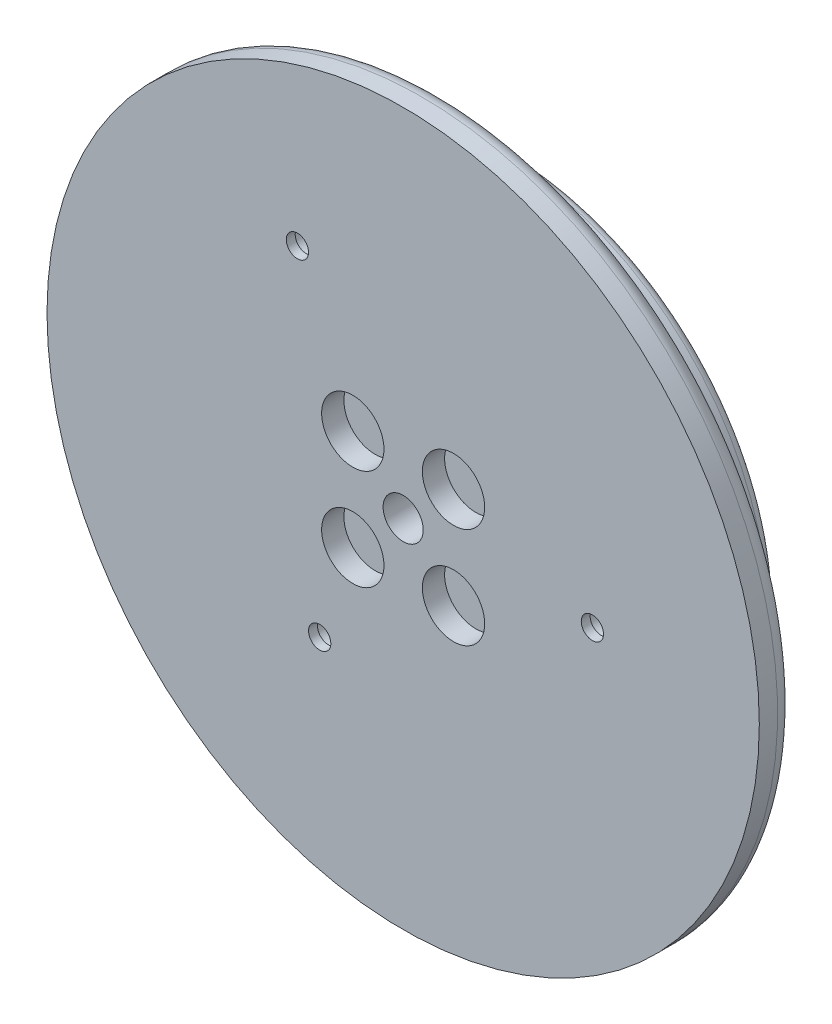
from build123d import *
from build123d.topology import SkipClean

# Parameters (mm, degrees)
SKETCH1_R             = 30
SKETCH1_R_2           = 12.5
BOSS_EXTRUDE1_DEPTH   = 6
SKETCH2_R             = 40
SKETCH2_R_2           = 2.25
SKETCH2_R_3           = 1.5
BOSS_EXTRUDE2_DEPTH   = 4
SKETCH3_R             = 3.5
CUT_EXTRUDE1_DEPTH    = 2.5
SKETCH4_R             = 5.15
CUT_EXTRUDE2_DEPTH    = 3
SKETCH5_R             = 3.5
BOSS_EXTRUDE3_DEPTH   = 0.2
SKETCH6_R             = 1.25
CUT_EXTRUDE3_DEPTH    = 10
SKETCH7_R             = 3.125
CUT_EXTRUDE4_DEPTH    = 9
SKETCH8_R             = 2
CUT_EXTRUDE5_DEPTH    = 8
SKETCH11_R            = 3
SKETCH11_R_2          = 1.5
BOSS_EXTRUDE6_DEPTH   = 3
BOSS_EXTRUDE6_2_DEPTH = 3
BOSS_EXTRUDE6_3_DEPTH = 3
SKETCH10_R            = 30
SKETCH10_R_2          = 5.15
SKETCH10_R_3          = 2
SKETCH10_R_4          = 12.5
BOSS_EXTRUDE7_DEPTH   = 1.2
FILLET1_R             = 10
FILLET2_R             = 2
BOSS_EXTRUDE8_START   = 2
SKETCH12_R            = 12.5
SKETCH12_R_2          = 2.25
SKETCH12_R_3          = 1.5
BOSS_EXTRUDE8_DEPTH   = 2
BOSS_EXTRUDE10_START  = 0.75
SKETCH15_R            = 30
SKETCH15_R_2          = 28
BOSS_EXTRUDE10_DEPTH  = 0.75
FILLET5_R             = 1
FILLET6_R             = 0.25


with BuildPart() as part:
    # Sketch1 → Boss-Extrude1 (new body)
    with BuildSketch(Plane.XY):
        Circle(SKETCH1_R)
        Circle(SKETCH1_R_2, mode=Mode.SUBTRACT)
    extrude(amount=BOSS_EXTRUDE1_DEPTH)

    # Sketch2 → Boss-Extrude2 (add)
    with BuildSketch(Plane.XY.offset(6)):
        Circle(SKETCH2_R)
        Circle(SKETCH2_R_2, mode=Mode.SUBTRACT)
        with Locations((-5.655999742, 5.657708628)):
            Circle(SKETCH2_R_3, mode=Mode.SUBTRACT)
        with Locations((-5.655999742, -5.657708628)):
            Circle(SKETCH2_R_3, mode=Mode.SUBTRACT)
        with Locations((5.655999742, -5.657708628)):
            Circle(SKETCH2_R_3, mode=Mode.SUBTRACT)
        with Locations((5.655999742, 5.657708628)):
            Circle(SKETCH2_R_3, mode=Mode.SUBTRACT)
    extrude(amount=BOSS_EXTRUDE2_DEPTH)

    # Sketch3 → Cut-Extrude1 (cut)
    with BuildSketch(Plane.XY.offset(10)):
        with Locations((-5.655999742, 5.657708628)):
            Circle(SKETCH3_R)
        with Locations((5.655999742, 5.657708628)):
            Circle(SKETCH3_R)
        with Locations((5.655999742, -5.657708628)):
            Circle(SKETCH3_R)
        with Locations((-5.655999742, -5.657708628)):
            Circle(SKETCH3_R)
    extrude(amount=-CUT_EXTRUDE1_DEPTH, mode=Mode.SUBTRACT)

    # Sketch4 → Cut-Extrude2 (cut)
    with BuildSketch(Plane(origin=(0, 0, 0), x_dir=(-1, 0, 0), z_dir=(0, 0, -1))):
        with Locations((20, 0)):
            Circle(SKETCH4_R)
    extrude(amount=-CUT_EXTRUDE2_DEPTH, mode=Mode.SUBTRACT)

    # Sketch5 → Boss-Extrude3 (add)
    with BuildSketch(Plane.XY.offset(7.5)):
        with Locations((-5.655999742, 5.657708628)):
            Circle(SKETCH5_R)
        with Locations((5.655999742, 5.657708628)):
            Circle(SKETCH5_R)
        with Locations((-5.655999742, -5.657708628)):
            Circle(SKETCH5_R)
        with Locations((5.655999742, -5.657708628)):
            Circle(SKETCH5_R)
    extrude(amount=-BOSS_EXTRUDE3_DEPTH)

    # Sketch6 → Cut-Extrude3 (cut)
    with BuildSketch(Plane(origin=(0, 0, 0), x_dir=(-1, 0, 0), z_dir=(0, 0, -1))):
        with Locations((-21.25, 0)):
            Circle(SKETCH6_R)
        with Locations((11.875, 20.56810334)):
            Circle(SKETCH6_R)
        with Locations((9.375, -16.237976321)):
            Circle(SKETCH6_R)
    extrude(amount=-CUT_EXTRUDE3_DEPTH, mode=Mode.SUBTRACT)

    # Sketch7 → Cut-Extrude4 (cut)
    with BuildSketch(Plane(origin=(0, 0, 0), x_dir=(-1, 0, 0), z_dir=(0, 0, -1))):
        with Locations((-21.25, 0)):
            Circle(SKETCH7_R)
        with Locations((11.875, 20.56810334)):
            Circle(SKETCH7_R)
        with Locations((9.375, -16.237976321)):
            Circle(SKETCH7_R)
    extrude(amount=-CUT_EXTRUDE4_DEPTH, mode=Mode.SUBTRACT)

    # Sketch8 → Cut-Extrude5 (cut)
    with BuildSketch(Plane(origin=(0, 0, 0), x_dir=(-1, 0, 0), z_dir=(0, 0, -1))):
        with Locations((-10, -17.320508076)):
            Circle(SKETCH8_R)
        with Locations((-10, 17.320508076)):
            Circle(SKETCH8_R)
        with Locations((17.320508076, -10)):
            Circle(SKETCH8_R)
        with Locations((0, -20)):
            Circle(SKETCH8_R)
        with Locations((-17.320508076, -10)):
            Circle(SKETCH8_R)
        with Locations((-17.320508076, 10)):
            Circle(SKETCH8_R)
        with Locations((0, 20)):
            Circle(SKETCH8_R)
        with Locations((17.320508076, 10)):
            Circle(SKETCH8_R)
    extrude(amount=-CUT_EXTRUDE5_DEPTH, mode=Mode.SUBTRACT)

    # Fillet1
    # the kernel refuses this fillet: 10 mm, written as the material it adds along each edge
    with BuildSketch(Plane(origin=(0, 0, 6), x_dir=(1, 0, 0), z_dir=(0, -1, 0))) as fillet1_piece_1:
        with BuildLine():
            CenterArc((39.16515139, -10), FILLET1_R, 90, 66.421821522)
            Line((30, -6), (29.816696972, -5.92))
            ThreePointArc((29.816696972, -5.92), (29.8, -3), (29.8, 0))
            Line((29.8, 0), (30, 0.2))
            Line((30, 0.2), (39.16515139, 0.2))
            Line((39.16515139, 0.2), (39.16515139, 0))
        make_face()
    revolve(axis=Axis((0, 0, 6), (0, 0, 1)))

    # Fillet2
    fillet2_edges = [part.edges().sort_by_distance(p)[0] for p in [
        (-40, 0, 6),
    ]]
    fillet(fillet2_edges, radius=FILLET2_R)

    # Sketch12 → Boss-Extrude8 (add)
    with BuildSketch(Plane(origin=(0, 0, 6), x_dir=(-1, 0, 0), z_dir=(0, 0, -1)).offset(BOSS_EXTRUDE8_START)):
        Circle(SKETCH12_R)
        Circle(SKETCH12_R_2, mode=Mode.SUBTRACT)
        with Locations((-5.655999742, 5.657708628)):
            Circle(SKETCH12_R_3, mode=Mode.SUBTRACT)
        with Locations((5.655999742, 5.657708628)):
            Circle(SKETCH12_R_3, mode=Mode.SUBTRACT)
        with Locations((5.655999742, -5.657708628)):
            Circle(SKETCH12_R_3, mode=Mode.SUBTRACT)
        with Locations((-5.655999742, -5.657708628)):
            Circle(SKETCH12_R_3, mode=Mode.SUBTRACT)
    extrude(amount=-BOSS_EXTRUDE8_DEPTH)


with BuildPart() as body_2:
    # Sketch11 → Boss-Extrude6 (new body)
    with BuildSketch(Plane(origin=(0, 0, 9), x_dir=(-1, 0, 0), z_dir=(0, 0, -1))):
        with Locations((-21.25, 0)):
            Circle(SKETCH11_R)
        with Locations((-21.25, 0)):
            Circle(SKETCH11_R_2, mode=Mode.SUBTRACT)
    extrude(amount=BOSS_EXTRUDE6_DEPTH)


with BuildPart() as body_3:
    # Sketch11 → Boss-Extrude6 2 (new body)
    with BuildSketch(Plane(origin=(0, 0, 9), x_dir=(-1, 0, 0), z_dir=(0, 0, -1))):
        with Locations((11.875, 20.56810334)):
            Circle(SKETCH11_R)
        with Locations((11.875, 20.56810334)):
            Circle(SKETCH11_R_2, mode=Mode.SUBTRACT)
    extrude(amount=BOSS_EXTRUDE6_2_DEPTH)


with BuildPart() as body_4:
    # Sketch11 → Boss-Extrude6 3 (new body)
    with BuildSketch(Plane(origin=(0, 0, 9), x_dir=(-1, 0, 0), z_dir=(0, 0, -1))):
        with Locations((9.375, -16.237976321)):
            Circle(SKETCH11_R)
        with Locations((9.375, -16.237976321)):
            Circle(SKETCH11_R_2, mode=Mode.SUBTRACT)
    extrude(amount=BOSS_EXTRUDE6_3_DEPTH)


with BuildPart() as body_5:
    # Sketch10 → Boss-Extrude7 (new body)
    with BuildSketch(Plane(origin=(0, 0, 0), x_dir=(-1, 0, 0), z_dir=(0, 0, -1))):
        Circle(SKETCH10_R)
        with Locations((20, 0)):
            Circle(SKETCH10_R_2, mode=Mode.SUBTRACT)
        with Locations((-10, 17.320508076)):
            Circle(SKETCH10_R_3, mode=Mode.SUBTRACT)
        with Locations((-10, -17.320508076)):
            Circle(SKETCH10_R_3, mode=Mode.SUBTRACT)
        with Locations((-17.320508076, 10)):
            Circle(SKETCH10_R_3, mode=Mode.SUBTRACT)
        with Locations((0, 20)):
            Circle(SKETCH10_R_3, mode=Mode.SUBTRACT)
        with Locations((17.320508076, 10)):
            Circle(SKETCH10_R_3, mode=Mode.SUBTRACT)
        with Locations((17.320508076, -10)):
            Circle(SKETCH10_R_3, mode=Mode.SUBTRACT)
        with Locations((0, -20)):
            Circle(SKETCH10_R_3, mode=Mode.SUBTRACT)
        with Locations((-17.320508076, -10)):
            Circle(SKETCH10_R_3, mode=Mode.SUBTRACT)
        Circle(SKETCH10_R_4, mode=Mode.SUBTRACT)
    extrude(amount=BOSS_EXTRUDE7_DEPTH)

    # Sketch15 → Boss-Extrude10 (add)
    # profile 1 of 5: a face of its own
    with SkipClean():  # the faces are left unmerged after this step: merging them gives an invalid solid
        with BuildSketch(Plane(origin=(0, 0, -1.2), x_dir=(-1, 0, 0), z_dir=(0, 0, -1)).offset(BOSS_EXTRUDE10_START)):
            Circle(SKETCH15_R)
            Circle(SKETCH15_R_2, mode=Mode.SUBTRACT)
        # profile 2 of 5: a face of its own
        with BuildSketch(Plane(origin=(0, 0, -1.2), x_dir=(-1, 0, 0), z_dir=(0, 0, -1)).offset(BOSS_EXTRUDE10_START)):
            with BuildLine():
                Line((13.125043176, 24.733241632), (5.363942493, 11.290620927))
                ThreePointArc((5.363942493, 11.290620927), (6.25, 10.825317547), (7.095993301, 10.290620927))
                Line((7.095993301, 10.290620927), (14.857093983, 23.733241632))
                ThreePointArc((14.857093983, 23.733241632), (14, 24.248711306), (13.125043176, 24.733241632))
            make_face()
        # profile 3 of 5: a face of its own
        with BuildSketch(Plane(origin=(0, 0, -1.2), x_dir=(-1, 0, 0), z_dir=(0, 0, -1)).offset(BOSS_EXTRUDE10_START)):
            with BuildLine():
                ThreePointArc((7.095993301, -10.290620927), (6.25, -10.825317547), (5.363942493, -11.290620927))
                Line((5.363942493, -11.290620927), (13.125043176, -24.733241632))
                ThreePointArc((13.125043176, -24.733241632), (14, -24.248711306), (14.857093983, -23.733241632))
                Line((14.857093983, -23.733241632), (7.095993301, -10.290620927))
            make_face()
        # profile 4 of 5: a face of its own
        with BuildSketch(Plane(origin=(0, 0, -1.2), x_dir=(-1, 0, 0), z_dir=(0, 0, -1)).offset(BOSS_EXTRUDE10_START)):
            with BuildLine():
                ThreePointArc((-12.459935794, -1), (-12.489979933, -0.500401124), (-12.5, 0))
                Line((-12.5, 0), (-28, 0))
                ThreePointArc((-28, 0), (-27.995533934, -0.500079764), (-27.982137159, -1))
                Line((-27.982137159, -1), (-12.459935794, -1))
            make_face()
        # profile 5 of 5: a face of its own
        with BuildSketch(Plane(origin=(0, 0, -1.2), x_dir=(-1, 0, 0), z_dir=(0, 0, -1)).offset(BOSS_EXTRUDE10_START)):
            with BuildLine():
                Line((-28, 0), (-12.5, 0))
                ThreePointArc((-12.5, 0), (-12.489979933, 0.500401124), (-12.459935794, 1))
                Line((-12.459935794, 1), (-27.982137159, 1))
                ThreePointArc((-27.982137159, 1), (-27.995533934, 0.500079764), (-28, 0))
            make_face()
        extrude(amount=-BOSS_EXTRUDE10_DEPTH)

    # Fillet5
    fillet5_edges = [body_5.edges().sort_by_distance(p)[0] for p in [
        (30, 0, -1.95),
    ]]
    fillet(fillet5_edges, radius=FILLET5_R)

    # Fillet6
    # the kernel refuses this fillet: 0.25 mm, written as the material it adds along each edge
    with BuildSketch(Plane(origin=(27.982137159, 1, -1.95), x_dir=(-1, 0, 0), z_dir=(0, 0, 1))) as fillet6_piece_1:
        with BuildLine():
            CenterArc((0.260304608, -0.25), FILLET6_R, 90, 92.581764562)
            ThreePointArc((0.010558369, -0.261261261), (0.004974213, -0.130642955), (0, 0))
            Line((0, 0), (0.260304608, 0))
        make_face()
    extrude(amount=1.403686306)
    with BuildSketch(Plane(origin=(-13.125043176, 24.733241632, -1.95), x_dir=(0.8855091183858967, 0.46462199824742706, 0), z_dir=(0, 0, 1))) as fillet6_piece_2:
        with BuildLine():
            CenterArc((0.260307225, -0.249997275), FILLET6_R, 89.732474268, 92.581764562)
            Line((0.010511128, -0.260092301), (0, 0))
            ThreePointArc((0, 0), (0.130737261, 0.00030522), (0.261474522, 0))
        make_face()
    extrude(amount=1.403686306)
    with BuildSketch(Plane(origin=(0, 0, -1.2), x_dir=(-0.48836330171597775, 0.8726404102132039, 0), z_dir=(-0.8726404102132039, -0.48836330171597775, 0))) as fillet6_piece_3_section:
        with BuildLine():
            CenterArc((28 - FILLET6_R, FILLET6_R), FILLET6_R, 270, 90)
            Line((28 - FILLET6_R, 0), (28, 0))
            Line((28, 0), (28, FILLET6_R))
        make_face()
    fillet6_piece_3 = revolve(axis=Axis((0, 0, -1.2), (0, 0, -1)), revolution_arc=118.466125604, mode=Mode.PRIVATE)
    fillet6_piece_3 = split(fillet6_piece_3, bisect_by=Plane(origin=(-13.101127788, 24.691818965, -1.256561941), z_dir=(-0.8660254037844388, -0.4999999999999996, 0)), keep=Keep.TOP, mode=Mode.PRIVATE)
    add(fillet6_piece_3)
    with BuildSketch(Plane(origin=(0, 0, -1.2), x_dir=(-0.48836330171597775, 0.8726404102132039, 0), z_dir=(-0.8726404102132039, -0.48836330171597775, 0))) as fillet6_piece_4_section:
        with BuildLine():
            CenterArc((28 - FILLET6_R, FILLET6_R), FILLET6_R, 270, 90)
            Line((28 - FILLET6_R, 0), (28, 0))
            Line((28, 0), (28, FILLET6_R))
        make_face()
    fillet6_piece_4 = revolve(axis=Axis((0, 0, -1.2), (0, 0, -1)), revolution_arc=118.466125604, mode=Mode.PRIVATE)
    fillet6_piece_4 = split(fillet6_piece_4, bisect_by=Plane(origin=(13.966802723, 1, -1.266394554), z_dir=(0, 1, 0)), keep=Keep.TOP, mode=Mode.PRIVATE)
    fillet6_piece_4 = split(fillet6_piece_4, bisect_by=Plane(origin=(-6.117375958, 12.595605968, -1.266394554), z_dir=(0.8660254037844388, 0.4999999999999996, 0)), keep=Keep.TOP, mode=Mode.PRIVATE)
    add(fillet6_piece_4)
    with BuildSketch(Plane(origin=(0, 0, -1.2), x_dir=(-0.48836330171597775, 0.8726404102132039, 0), z_dir=(-0.8726404102132039, -0.48836330171597775, 0))) as fillet6_piece_5_section:
        with BuildLine():
            CenterArc((28 - FILLET6_R, FILLET6_R), FILLET6_R, 270, 90)
            Line((28 - FILLET6_R, 0), (28, 0))
            Line((28, 0), (28, FILLET6_R))
        make_face()
    fillet6_piece_5 = revolve(axis=Axis((0, 0, -1.2), (0, 0, -1)), revolution_arc=118.466125604, mode=Mode.PRIVATE)
    fillet6_piece_5 = split(fillet6_piece_5, bisect_by=Plane(origin=(27.934306789, 1, -1.256562051), z_dir=(0, -1, 0)), keep=Keep.TOP, mode=Mode.PRIVATE)
    add(fillet6_piece_5)
    with BuildSketch(Plane(origin=(28.607137159, -1, -1.2), x_dir=(0, 0, -1), z_dir=(-1, 0, 0))) as fillet6_piece_6_section:
        with BuildLine():
            CenterArc((FILLET6_R, FILLET6_R), FILLET6_R, 180, 90)
            Line((0, FILLET6_R), (0, 0))
            Line((0, 0), (FILLET6_R, 0))
        make_face()
    fillet6_piece_6 = extrude(amount=16.772201365, mode=Mode.PRIVATE)
    fillet6_piece_6 = fillet6_piece_6 - Plane(origin=(0, 0, -1.256493782), x_dir=(-1, 0, 0), z_dir=(0, 0, 1)) * Cylinder(12.5, 35, mode=Mode.PRIVATE)
    add(fillet6_piece_6)
    # the kernel refuses this fillet: 0.25 mm, written as the material it takes off along each edge
    with BuildSketch(Plane(origin=(-6.783493301, 9.74935505, -1.95), x_dir=(0.8660254037844389, 0.49999999999999944, 0), z_dir=(-0.4999999999999995, 0.866025403784439, 0))) as fillet6_2_piece_1_section:
        with BuildLine():
            CenterArc((FILLET6_R, -FILLET6_R), FILLET6_R, 90, 90)
            Line((0, -FILLET6_R), (0, 0))
            Line((0, 0), (FILLET6_R, 0))
        make_face()
    fillet6_2_piece_1 = extrude(amount=16.772201365, mode=Mode.PRIVATE)
    fillet6_2_piece_1 = fillet6_2_piece_1 & Plane(origin=(0, 0, -1.89340474), x_dir=(-1, 0, 0), z_dir=(0, 0, -1)) * Cylinder(28, 35, mode=Mode.PRIVATE)
    add(fillet6_2_piece_1, mode=Mode.SUBTRACT)
    with BuildSketch(Plane(origin=(0, 0, -1.95), x_dir=(-0.5115471127554413, 0.8592552306687297, 0), z_dir=(0.8592552306687297, 0.5115471127554413, 0))) as fillet6_2_piece_2_section:
        with BuildLine():
            CenterArc((28 + FILLET6_R, FILLET6_R), FILLET6_R, 180, 90)
            Line((28, FILLET6_R), (28, 0))
            Line((28, 0), (28 + FILLET6_R, 0))
        make_face()
    fillet6_2_piece_2 = revolve(axis=Axis((0, 0, -1.95), (0, 0, 1)), revolution_arc=118.466125604, mode=Mode.PRIVATE)
    fillet6_2_piece_2 = split(fillet6_2_piece_2, bisect_by=Plane(origin=(-7.882621422, -11.6531008, -1.883615927), z_dir=(-0.8660254037844384, 0.5000000000000007, 0)), keep=Keep.TOP, mode=Mode.PRIVATE)
    fillet6_2_piece_2 = split(fillet6_2_piece_2, bisect_by=Plane(origin=(-7.882621422, 11.6531008, -1.883615927), z_dir=(-0.866025403784439, -0.4999999999999995, 0)), keep=Keep.TOP, mode=Mode.PRIVATE)
    add(fillet6_2_piece_2, mode=Mode.SUBTRACT)
    with BuildSketch(Plane(origin=(-15.169593983, -24.274507509, -1.95), x_dir=(0.8660254037844383, -0.5000000000000007, 0), z_dir=(0.5000000000000007, 0.8660254037844384, 0))) as fillet6_2_piece_3_section:
        with BuildLine():
            CenterArc((FILLET6_R, -FILLET6_R), FILLET6_R, 90, 90)
            Line((0, -FILLET6_R), (0, 0))
            Line((0, 0), (FILLET6_R, 0))
        make_face()
    fillet6_2_piece_3 = extrude(amount=16.772201365, mode=Mode.PRIVATE)
    fillet6_2_piece_3 = fillet6_2_piece_3 & Plane(origin=(0, 0, -1.89340474), x_dir=(-1, 0, 0), z_dir=(0, 0, -1)) * Cylinder(28, 35, mode=Mode.PRIVATE)
    add(fillet6_2_piece_3, mode=Mode.SUBTRACT)
    with BuildSketch(Plane(origin=(-5.051442493, -10.74935505, -1.95), x_dir=(-0.8660254037844384, 0.5000000000000007, 0), z_dir=(-0.5000000000000007, -0.8660254037844384, 0))) as fillet6_2_piece_4_section:
        with BuildLine():
            CenterArc((FILLET6_R, -FILLET6_R), FILLET6_R, 90, 90)
            Line((0, -FILLET6_R), (0, 0))
            Line((0, 0), (FILLET6_R, 0))
        make_face()
    fillet6_2_piece_4 = extrude(amount=16.772201365, mode=Mode.PRIVATE)
    fillet6_2_piece_4 = fillet6_2_piece_4 & Plane(origin=(0, 0, -1.89340474), x_dir=(-1, 0, 0), z_dir=(0, 0, -1)) * Cylinder(28, 35, mode=Mode.PRIVATE)
    add(fillet6_2_piece_4, mode=Mode.SUBTRACT)
    with BuildSketch(Plane(origin=(0, 0, -1.95), x_dir=(0.9999104144714976, -0.013385179544476315, 0), z_dir=(0.013385179544476315, 0.9999104144714976, 0))) as fillet6_2_piece_5_section:
        with BuildLine():
            CenterArc((28 + FILLET6_R, -FILLET6_R), FILLET6_R, 90, 90)
            Line((28, -FILLET6_R), (28, 0))
            Line((28, 0), (28 + FILLET6_R, 0))
        make_face()
    fillet6_2_piece_5 = revolve(axis=Axis((0, 0, -1.95), (0, 0, -1)), revolution_arc=118.466125604, mode=Mode.PRIVATE)
    fillet6_2_piece_5 = split(fillet6_2_piece_5, bisect_by=Plane(origin=(-6.150570614, -12.6531008, -1.883615927), z_dir=(0.8660254037844384, -0.5000000000000007, 0)), keep=Keep.TOP, mode=Mode.PRIVATE)
    fillet6_2_piece_5 = split(fillet6_2_piece_5, bisect_by=Plane(origin=(14.033192036, -1, -1.883615927), z_dir=(0, -1, 0)), keep=Keep.TOP, mode=Mode.PRIVATE)
    add(fillet6_2_piece_5, mode=Mode.SUBTRACT)
    with BuildSketch(Plane(origin=(0, 0, -1.95), x_dir=(-0.5115471127554413, 0.8592552306687297, 0), z_dir=(0.8592552306687297, 0.5115471127554413, 0))) as fillet6_2_piece_6a_section:
        with BuildLine():
            CenterArc((28 + FILLET6_R, FILLET6_R), FILLET6_R, 180, 90)
            Line((28, FILLET6_R), (28, 0))
            Line((28, 0), (28 + FILLET6_R, 0))
        make_face()
    fillet6_2_piece_6a = revolve(axis=Axis((0, 0, -1.95), (0, 0, 1)), revolution_arc=118.466125604, mode=Mode.PRIVATE)
    fillet6_2_piece_6a = split(fillet6_2_piece_6a, bisect_by=Plane(origin=(-14.889788046, 23.78986941, -1.893364521), z_dir=(0.866025403784439, 0.4999999999999995, 0)), keep=Keep.TOP, mode=Mode.PRIVATE)
    with BuildSketch(Plane(origin=(-6.783493301, 9.74935505, -1.95), x_dir=(0.8660254037844389, 0.49999999999999944, 0), z_dir=(-0.4999999999999995, 0.866025403784439, 0))) as fillet6_2_piece_6b_section:
        with BuildLine():
            CenterArc((FILLET6_R, -FILLET6_R), FILLET6_R, 90, 90)
            Line((0, -FILLET6_R), (0, 0))
            Line((0, 0), (FILLET6_R, 0))
        make_face()
    fillet6_2_piece_6b = extrude(amount=16.772201365, mode=Mode.PRIVATE)
    fillet6_2_piece_6b = fillet6_2_piece_6b - Plane(origin=(0, 0, -1.893310049), x_dir=(-1, 0, 0), z_dir=(0, 0, -1)) * Cylinder(28, 35, mode=Mode.PRIVATE)
    fillet6_2_piece_6 = fillet6_2_piece_6a & fillet6_2_piece_6b
    add(fillet6_2_piece_6, mode=Mode.SUBTRACT)
    with BuildSketch(Plane(origin=(0, 0, -1.95), x_dir=(-0.5115471127554413, 0.8592552306687297, 0), z_dir=(0.8592552306687297, 0.5115471127554413, 0))) as fillet6_2_piece_7a_section:
        with BuildLine():
            CenterArc((28 + FILLET6_R, FILLET6_R), FILLET6_R, 180, 90)
            Line((28, FILLET6_R), (28, 0))
            Line((28, 0), (28 + FILLET6_R, 0))
        make_face()
    fillet6_2_piece_7a = revolve(axis=Axis((0, 0, -1.95), (0, 0, 1)), revolution_arc=118.466125604, mode=Mode.PRIVATE)
    fillet6_2_piece_7a = split(fillet6_2_piece_7a, bisect_by=Plane(origin=(-14.889787852, -23.789869074, -1.893364409), z_dir=(0.8660254037844384, -0.5000000000000007, 0)), keep=Keep.TOP, mode=Mode.PRIVATE)
    with BuildSketch(Plane(origin=(-15.169593983, -24.274507509, -1.95), x_dir=(0.8660254037844383, -0.5000000000000007, 0), z_dir=(0.5000000000000007, 0.8660254037844384, 0))) as fillet6_2_piece_7b_section:
        with BuildLine():
            CenterArc((FILLET6_R, -FILLET6_R), FILLET6_R, 90, 90)
            Line((0, -FILLET6_R), (0, 0))
            Line((0, 0), (FILLET6_R, 0))
        make_face()
    fillet6_2_piece_7b = extrude(amount=16.772201365, mode=Mode.PRIVATE)
    fillet6_2_piece_7b = fillet6_2_piece_7b - Plane(origin=(0, 0, -1.893310049), x_dir=(-1, 0, 0), z_dir=(0, 0, -1)) * Cylinder(28, 35, mode=Mode.PRIVATE)
    fillet6_2_piece_7 = fillet6_2_piece_7a & fillet6_2_piece_7b
    add(fillet6_2_piece_7, mode=Mode.SUBTRACT)
    with BuildSketch(Plane(origin=(-5.051442493, -10.74935505, -1.95), x_dir=(-0.8660254037844384, 0.5000000000000007, 0), z_dir=(-0.5000000000000007, -0.8660254037844384, 0))) as fillet6_2_piece_8a_section:
        with BuildLine():
            CenterArc((FILLET6_R, -FILLET6_R), FILLET6_R, 90, 90)
            Line((0, -FILLET6_R), (0, 0))
            Line((0, 0), (FILLET6_R, 0))
        make_face()
    fillet6_2_piece_8a = extrude(amount=16.772201365, mode=Mode.PRIVATE)
    fillet6_2_piece_8a = fillet6_2_piece_8a - Plane(origin=(0, 0, -1.893310049), x_dir=(-1, 0, 0), z_dir=(0, 0, -1)) * Cylinder(28, 35, mode=Mode.PRIVATE)
    with BuildSketch(Plane(origin=(0, 0, -1.95), x_dir=(0.9999104144714976, -0.013385179544476315, 0), z_dir=(0.013385179544476315, 0.9999104144714976, 0))) as fillet6_2_piece_8b_section:
        with BuildLine():
            CenterArc((28 + FILLET6_R, -FILLET6_R), FILLET6_R, 90, 90)
            Line((28, -FILLET6_R), (28, 0))
            Line((28, 0), (28 + FILLET6_R, 0))
        make_face()
    fillet6_2_piece_8b = revolve(axis=Axis((0, 0, -1.95), (0, 0, -1)), revolution_arc=118.466125604, mode=Mode.PRIVATE)
    fillet6_2_piece_8b = split(fillet6_2_piece_8b, bisect_by=Plane(origin=(-13.15773709, -24.789869152, -1.893364458), z_dir=(-0.8660254037844384, 0.5000000000000007, 0)), keep=Keep.TOP, mode=Mode.PRIVATE)
    fillet6_2_piece_8 = fillet6_2_piece_8a & fillet6_2_piece_8b
    add(fillet6_2_piece_8, mode=Mode.SUBTRACT)
    # the kernel refuses this fillet: 0.25 mm, written as the material it takes off along each edge
    with BuildSketch(Plane(origin=(11.834935794, 1, -1.95), x_dir=(0, -1, 0), z_dir=(1, 0, 0)), Plane(origin=(-12.994890872, 24.507811229, -1.95), x_dir=(-0.8660254037844389, -0.49999999999999967, 0), z_dir=(0.49999999999999967, -0.8660254037844389, 0))) as fillet6_3_piece_1:
        with BuildLine():
            CenterArc((FILLET6_R, -FILLET6_R), FILLET6_R, 90, 90)
            Line((0, -FILLET6_R), (0, 0))
            Line((0, 0), (FILLET6_R, 0))
        make_face()
    extrude(amount=15.886896757, mode=Mode.SUBTRACT)
    with BuildSketch(Plane(origin=(0, 0, -1.95), x_dir=(-0.4604823250773849, 0.8876688731116608, 0), z_dir=(-0.8876688731116608, -0.4604823250773849, 0))) as fillet6_3_piece_2:
        with BuildLine():
            CenterArc((28 + FILLET6_R, -FILLET6_R), FILLET6_R, 90, 90)
            Line((28, -FILLET6_R), (28, 0))
            Line((28, 0), (28 + FILLET6_R, 0))
        make_face()
    revolve(axis=Axis((0, 0, -1.95), (0, 0, -1)), revolution_arc=114.836470875, mode=Mode.SUBTRACT)
    with BuildSketch(Plane(origin=(-12.778384521, 24.632811229, -1.95), x_dir=(-0.46048232507738446, 0.8876688731116611, 0), z_dir=(0.8876688731116611, 0.46048232507738446, 0))) as fillet6_3_piece_3:
        with BuildLine():
            CenterArc((0.25 + FILLET6_R, FILLET6_R), FILLET6_R, 180, 90)
            Line((0.25, FILLET6_R), (0.25, 0))
            Line((0.25, 0), (0.25 + FILLET6_R, 0))
        make_face()
    revolve(axis=Axis((-12.778384521, 24.632811229, -1.95), (0, 0, 1)), revolution_arc=92.581764562, mode=Mode.SUBTRACT)
    with BuildSketch(Plane(origin=(27.721832551, 1.25, -1.95), x_dir=(0, -1, 0), z_dir=(-1, 0, 0))) as fillet6_3_piece_4:
        with BuildLine():
            CenterArc((0.25 + FILLET6_R, FILLET6_R), FILLET6_R, 180, 90)
            Line((0.25, FILLET6_R), (0.25, 0))
            Line((0.25, 0), (0.25 + FILLET6_R, 0))
        make_face()
    revolve(axis=Axis((27.721832551, 1.25, -1.95), (0, 0, 1)), revolution_arc=92.581764562, mode=Mode.SUBTRACT)


solid = Compound([part.part, body_2.part, body_3.part, body_4.part, body_5.part])
